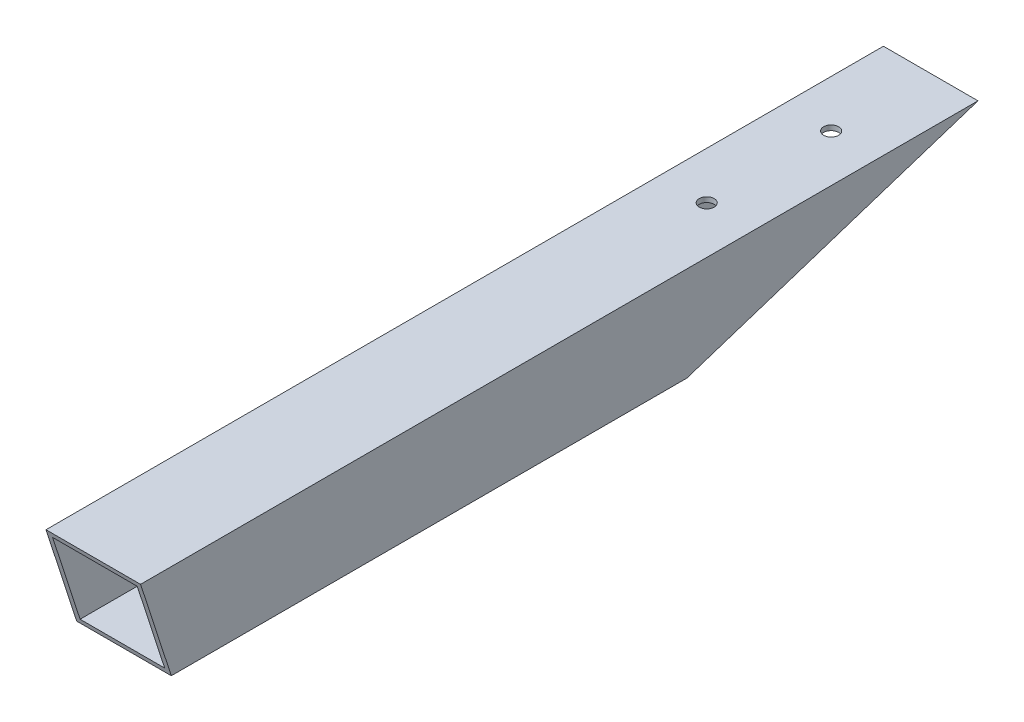
from build123d import *

# Parameters (mm, degrees)
ESBO_O1_W                = 19
ESBO_O1_H                = 19
RESSALTO_EXTRUS_O1_DEPTH = 260
CASCA2_T                 = -1
CORTE_EXTRUS_O1_DEPTH    = 261.866345089
CORTE_EXTRUS_O3_DEPTH    = 261.866345089
ESBO_O5_R                = 1.5
CORTE_EXTRUS_O4_DEPTH    = 170.569790677


with BuildPart() as part:
    # Esboço1 → Ressalto-extrusão1 (new body)
    with BuildSketch(Plane.XY):
        Rectangle(ESBO_O1_W, ESBO_O1_H)
    extrude(amount=RESSALTO_EXTRUS_O1_DEPTH)

    # Casca2
    casca2_openings = [part.faces().sort_by_distance(p)[0] for p in [
        (0, 0, 0),
        (0, 0, 260),
    ]]
    offset(amount=CASCA2_T, openings=casca2_openings, kind=Kind.INTERSECTION)

    # Esboço2 → Corte-extrusão1 (cut, through all)
    with BuildSketch(Plane(origin=(9.5, 0, 0), x_dir=(0, 0, -1), z_dir=(1, 0, 0))):
        Polygon((0, 9.5), (-58.475987206, -9.5), (0, -9.5), align=None)
    extrude(amount=-CORTE_EXTRUS_O1_DEPTH, mode=Mode.SUBTRACT)

    # Esboço4 → Corte-extrusão3 (cut, through all)
    with BuildSketch(Plane(origin=(9.5, 0, 0), x_dir=(0, 0, -1), z_dir=(1, 0, 0))):
        Polygon((-168.550335734, 10.473717073), (-161.289503816, -11.872825786), (-264.812755879, -45.509569399), (-289.05777752, 22.149749677), (-184.516070462, 59.611196004), align=None)
    extrude(amount=-CORTE_EXTRUS_O3_DEPTH, mode=Mode.SUBTRACT)

    # Esboço5 → Corte-extrusão4 (cut, through all)
    with BuildSketch(Plane(origin=(0, 9.5, 0), x_dir=(1, 0, 0), z_dir=(0, 1, 0))):
        with Locations((0, -20)):
            Circle(ESBO_O5_R)
        with Locations((0, -45)):
            Circle(ESBO_O5_R)
    extrude(amount=-CORTE_EXTRUS_O4_DEPTH, mode=Mode.SUBTRACT)


solid = part.part
